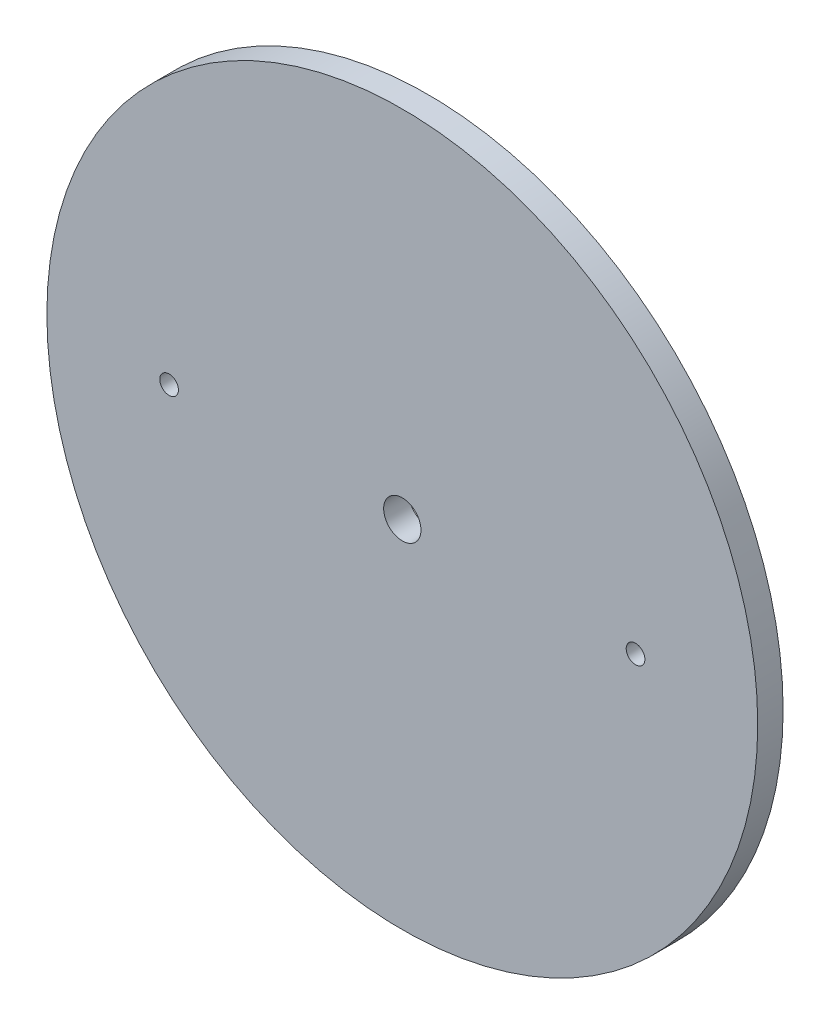
from build123d import *

# Parameters (mm, degrees)
SKETCH1_R           = 70
SKETCH1_R_2         = 1.837270341
SKETCH1_R_3         = 3.674540682
BOSS_EXTRUDE1_DEPTH = 5


with BuildPart() as part:
    # Sketch1 → Boss-Extrude1 (new body)
    with BuildSketch(Plane(origin=(0, 0, -5), x_dir=(-1, 0, 0), z_dir=(0, 0, -1))):
        Circle(SKETCH1_R)
        with Locations((45.93175853, 0)):
            Circle(SKETCH1_R_2, mode=Mode.SUBTRACT)
        with Locations((-45.93175853, 0)):
            Circle(SKETCH1_R_2, mode=Mode.SUBTRACT)
        Circle(SKETCH1_R_3, mode=Mode.SUBTRACT)
    extrude(amount=-BOSS_EXTRUDE1_DEPTH)


solid = part.part
